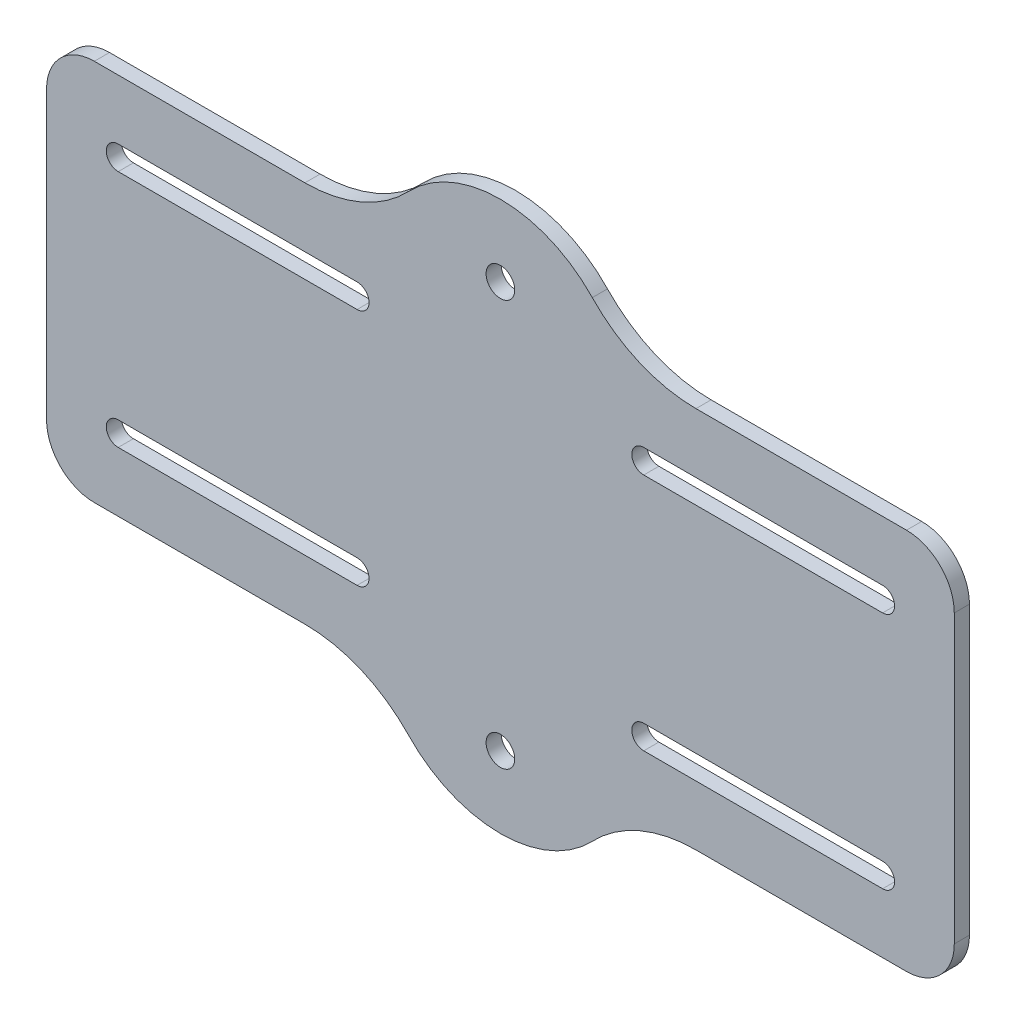
from build123d import *

# Parameters (mm, degrees)
SKETCH1_R           = 3
BOSS_EXTRUDE1_DEPTH = 3.175
FILLET1_R           = 10
FILLET2_R           = 30


with BuildPart() as part:
    # Sketch1 → Boss-Extrude1 (new body)
    with BuildSketch(Plane.XY):
        with BuildLine():
            Line((-95, -40), (-25, -40))
            ThreePointArc((-25, -40), (0, -57.5), (25, -40))
            Line((25, -40), (95, -40))
            Line((95, -40), (95, 40))
            Line((95, 40), (25, 40))
            ThreePointArc((25, 40), (0, 57.5), (-25, 40))
            Line((-25, 40), (-95, 40))
            Line((-95, 40), (-95, -40))
        make_face()
        with Locations((0, 42.5)):
            Circle(SKETCH1_R, mode=Mode.SUBTRACT)
        with Locations((0, -42.5)):
            Circle(SKETCH1_R, mode=Mode.SUBTRACT)
        with BuildLine():
            Line((30, 27.5), (80, 27.5))
            ThreePointArc((80, 27.5), (82.5, 25), (80, 22.5))
            Line((80, 22.5), (30, 22.5))
            ThreePointArc((30, 22.5), (27.5, 25), (30, 27.5))
        make_face(mode=Mode.SUBTRACT)
        with BuildLine():
            Line((30, -27.5), (80, -27.5))
            ThreePointArc((80, -27.5), (82.5, -25), (80, -22.5))
            Line((80, -22.5), (30, -22.5))
            ThreePointArc((30, -22.5), (27.5, -25), (30, -27.5))
        make_face(mode=Mode.SUBTRACT)
        with BuildLine():
            Line((-30, 27.5), (-80, 27.5))
            ThreePointArc((-80, 27.5), (-82.5, 25), (-80, 22.5))
            Line((-80, 22.5), (-30, 22.5))
            ThreePointArc((-30, 22.5), (-27.5, 25), (-30, 27.5))
        make_face(mode=Mode.SUBTRACT)
        with BuildLine():
            Line((-30, -27.5), (-80, -27.5))
            ThreePointArc((-80, -27.5), (-82.5, -25), (-80, -22.5))
            Line((-80, -22.5), (-30, -22.5))
            ThreePointArc((-30, -22.5), (-27.5, -25), (-30, -27.5))
        make_face(mode=Mode.SUBTRACT)
    extrude(amount=BOSS_EXTRUDE1_DEPTH)

    # Fillet1
    fillet1_edges = [part.edges().sort_by_distance(p)[0] for p in [
        (-95, -40, 1.5875),
        (-95, 40, 1.5875),
        (95, -40, 1.5875),
        (95, 40, 1.5875),
    ]]
    fillet(fillet1_edges, radius=FILLET1_R)

    # Fillet2
    fillet2_edges = [part.edges().sort_by_distance(p)[0] for p in [
        (25, -40, 1.5875),
        (-25, -40, 1.5875),
        (25, 40, 1.5875),
        (-25, 40, 1.5875),
    ]]
    fillet(fillet2_edges, radius=FILLET2_R)


solid = part.part
